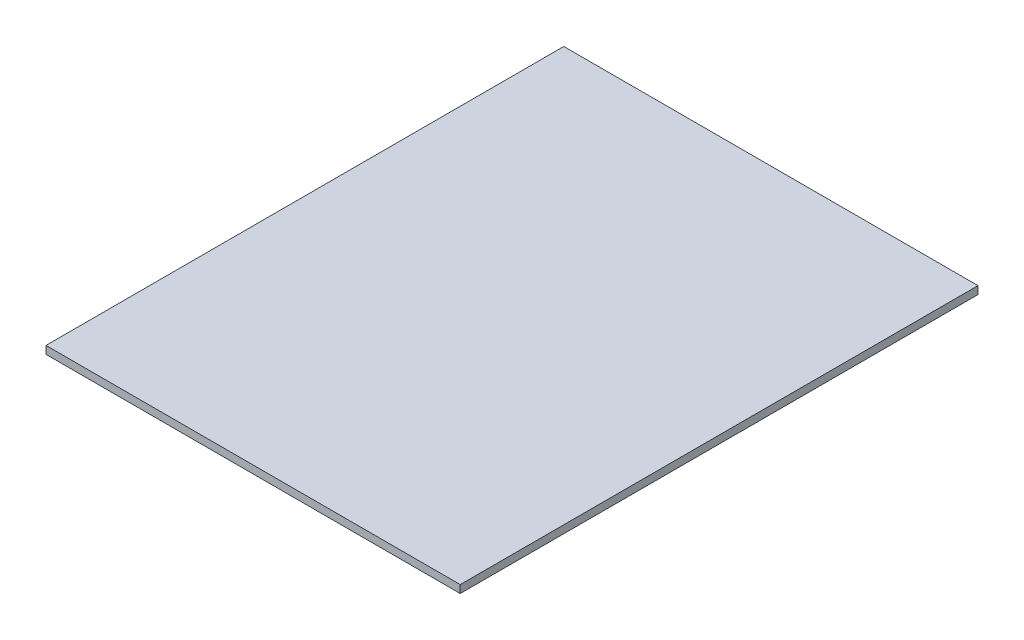
from build123d import *

# Parameters (mm, degrees)
SKETCH1_W           = 160
SKETCH1_H           = 200
BOSS_EXTRUDE1_DEPTH = 3


with BuildPart() as part:
    # Sketch1 → Boss-Extrude1 (new body)
    with BuildSketch(Plane(origin=(0, 0, 0), x_dir=(1, 0, 0), z_dir=(0, 1, 0))):
        Rectangle(SKETCH1_W, SKETCH1_H)
    extrude(amount=BOSS_EXTRUDE1_DEPTH)


solid = part.part
